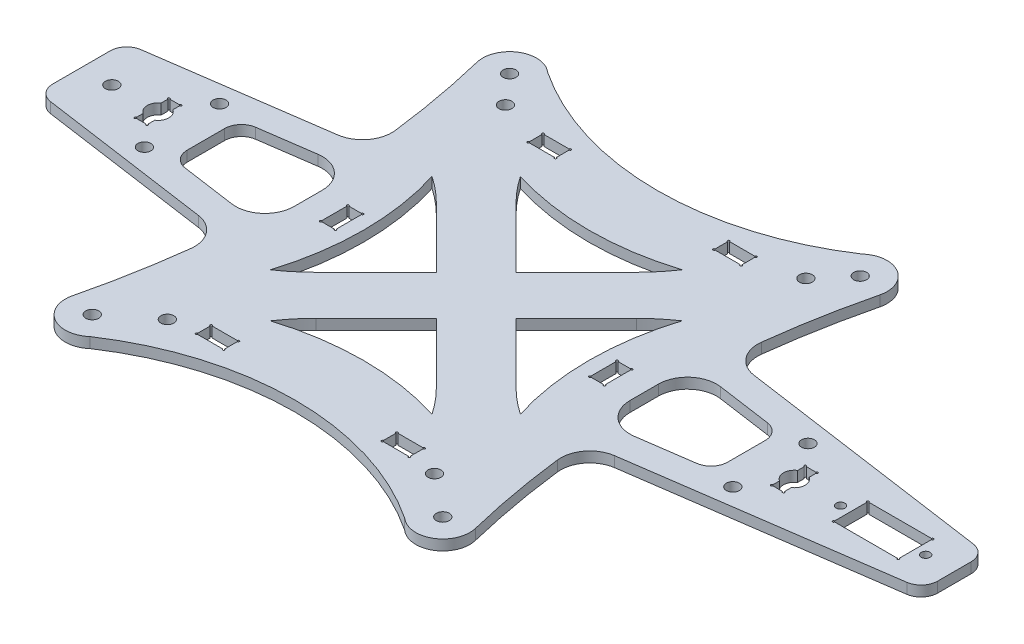
from build123d import *

# Parameters (mm, degrees)
SKETCH_1_R          = 1.55
SKETCH_1_R_2        = 1.05
SKETCH_1_W          = 6.5
SKETCH_1_H          = 3.5
SKETCH_1_W_2        = 3.5
SKETCH_1_H_2        = 6.5
SKETCH_1_W_3        = 15.5
SKETCH_1_H_3        = 8.2
EXTRUDE_1_DEPTH     = 2.5
FILLET_1_R          = 4
FILLET_2_R          = 7
SKETCH_2_R          = 0.25
CUT_EXTRUDE_1_DEPTH = 128.770204339


with BuildPart() as part:
    # 草图1 → 凸台-拉伸1 (new body)
    with BuildSketch(Plane(origin=(0, 0, 0), x_dir=(1, 0, 0), z_dir=(0, 1, 0))):
        with BuildLine():
            Line((114.591143215, 7.468307572), (114.591143215, -7.468307572))
            Line((114.591143215, -7.468307572), (43.193640968, -17.646273029))
            ThreePointArc((43.193640968, -17.646273029), (45.143245402, -33.15226541), (48.27557779, -48.463217404))
            ThreePointArc((48.27557779, -48.463217404), (45.335063646, -55.533708325), (37.709796983, -54.831018053))
            ThreePointArc((37.709796983, -54.831018053), (0, -43.436211003), (-37.709796983, -54.831018053))
            ThreePointArc((-37.709796983, -54.831018053), (-45.335063646, -55.533708325), (-48.27557779, -48.463217404))
            ThreePointArc((-48.27557779, -48.463217404), (-45.143245402, -33.15226541), (-43.193640968, -17.646273029))
            Line((-43.193640968, -17.646273029), (-94.579518436, -10.321035179))
            Line((-94.579518436, -10.321035179), (-94.579518436, 10.321035179))
            Line((-94.579518436, 10.321035179), (-43.193640968, 17.646273029))
            ThreePointArc((-43.193640968, 17.646273029), (-45.143245402, 33.15226541), (-48.27557779, 48.463217404))
            ThreePointArc((-48.27557779, 48.463217404), (-45.335063646, 55.533708325), (-37.709796983, 54.831018053))
            ThreePointArc((-37.709796983, 54.831018053), (0, 43.436211003), (37.709796983, 54.831018053))
            ThreePointArc((37.709796983, 54.831018053), (45.335063646, 55.533708325), (48.27557779, 48.463217404))
            ThreePointArc((48.27557779, 48.463217404), (45.143245402, 33.15226541), (43.193640968, 17.646273029))
            Line((43.193640968, 17.646273029), (114.591143215, 7.468307572))
        make_face()
        with Locations((-36, 43)):
            Circle(SKETCH_1_R, mode=Mode.SUBTRACT)
        with Locations((-32, -42)):
            Circle(SKETCH_1_R, mode=Mode.SUBTRACT)
        with Locations((32, -42)):
            Circle(SKETCH_1_R, mode=Mode.SUBTRACT)
        with Locations((36, 43)):
            Circle(SKETCH_1_R, mode=Mode.SUBTRACT)
        with Locations((42, 50)):
            Circle(SKETCH_1_R, mode=Mode.SUBTRACT)
        with Locations((42, -50)):
            Circle(SKETCH_1_R, mode=Mode.SUBTRACT)
        with Locations((-42, -50)):
            Circle(SKETCH_1_R, mode=Mode.SUBTRACT)
        with Locations((-42, 50)):
            Circle(SKETCH_1_R, mode=Mode.SUBTRACT)
        with Locations((107.7, 0)):
            Circle(SKETCH_1_R_2, mode=Mode.SUBTRACT)
        with Locations((87.3, 0)):
            Circle(SKETCH_1_R_2, mode=Mode.SUBTRACT)
        with Locations((70.5, 9)):
            Circle(SKETCH_1_R, mode=Mode.SUBTRACT)
        with Locations((70.5, -9)):
            Circle(SKETCH_1_R, mode=Mode.SUBTRACT)
        with Locations((-70.5, -9)):
            Circle(SKETCH_1_R, mode=Mode.SUBTRACT)
        with Locations((-70.5, 9)):
            Circle(SKETCH_1_R, mode=Mode.SUBTRACT)
        with Locations((-87.3, 0)):
            Circle(SKETCH_1_R, mode=Mode.SUBTRACT)
        with Locations((-22.25, 39.75)):
            Rectangle(SKETCH_1_W, SKETCH_1_H, mode=Mode.SUBTRACT)
        with Locations((-32.25, 0)):
            Rectangle(SKETCH_1_W_2, SKETCH_1_H_2, mode=Mode.SUBTRACT)
        with Locations((-22.25, -39.75)):
            Rectangle(SKETCH_1_W, SKETCH_1_H, mode=Mode.SUBTRACT)
        with Locations((22.25, 39.75)):
            Rectangle(SKETCH_1_W, SKETCH_1_H, mode=Mode.SUBTRACT)
        with Locations((22.25, -39.75)):
            Rectangle(SKETCH_1_W, SKETCH_1_H, mode=Mode.SUBTRACT)
        with Locations((32.25, 0)):
            Rectangle(SKETCH_1_W_2, SKETCH_1_H_2, mode=Mode.SUBTRACT)
        with BuildLine():
            Line((77.65, -2.151778405), (77.65, -4))
            Line((77.65, -4), (74.85, -4))
            Line((74.85, -4), (74.85, -2.176778405))
            ThreePointArc((74.85, -2.176778405), (73.652957971, 0), (74.85, 2.176778405))
            Line((74.85, 2.176778405), (74.85, 4))
            Line((74.85, 4), (77.65, 4))
            Line((77.65, 4), (77.65, 2.151778405))
            ThreePointArc((77.65, 2.151778405), (78.8083942, 0), (77.65, -2.151778405))
        make_face(mode=Mode.SUBTRACT)
        with Locations((97.5, 0)):
            Rectangle(SKETCH_1_W_3, SKETCH_1_H_3, mode=Mode.SUBTRACT)
        with BuildLine():
            Line((-74.85, -2.176778405), (-74.85, -4))
            Line((-74.85, -4), (-77.65, -4))
            Line((-77.65, -4), (-77.65, -2.151778405))
            ThreePointArc((-77.65, -2.151778405), (-78.8083942, 0), (-77.65, 2.151778405))
            Line((-77.65, 2.151778405), (-77.65, 4))
            Line((-77.65, 4), (-74.85, 4))
            Line((-74.85, 4), (-74.85, 2.176778405))
            ThreePointArc((-74.85, 2.176778405), (-73.652957971, 0), (-74.85, -2.176778405))
        make_face(mode=Mode.SUBTRACT)
        with BuildLine():
            Line((-23.978041684, 14.429581723), (-9.54845996, 0))
            Line((-9.54845996, 0), (-23.978041684, -14.429581723))
            ThreePointArc((-23.978041684, -14.429581723), (-26.851664039, -17.042325553), (-29.960234119, -19.370614155))
            ThreePointArc((-29.960234119, -19.370614155), (-27.006361348, 0), (-29.960234119, 19.370614155))
            ThreePointArc((-29.960234119, 19.370614155), (-26.851664039, 17.042325553), (-23.978041684, 14.429581723))
        make_face(mode=Mode.SUBTRACT)
        with BuildLine():
            Line((14.429581723, 23.978041684), (0, 9.54845996))
            Line((0, 9.54845996), (-14.429581723, 23.978041684))
            ThreePointArc((-14.429581723, 23.978041684), (-17.042325553, 26.851664039), (-19.370614155, 29.960234119))
            ThreePointArc((-19.370614155, 29.960234119), (0, 27.006361348), (19.370614155, 29.960234119))
            ThreePointArc((19.370614155, 29.960234119), (17.042325553, 26.851664039), (14.429581723, 23.978041684))
        make_face(mode=Mode.SUBTRACT)
        with BuildLine():
            Line((23.978041684, -14.429581723), (9.54845996, 0))
            Line((9.54845996, 0), (23.978041684, 14.429581723))
            ThreePointArc((23.978041684, 14.429581723), (26.851664039, 17.042325553), (29.960234119, 19.370614155))
            ThreePointArc((29.960234119, 19.370614155), (27.006361348, 0), (29.960234119, -19.370614155))
            ThreePointArc((29.960234119, -19.370614155), (26.851664039, -17.042325553), (23.978041684, -14.429581723))
        make_face(mode=Mode.SUBTRACT)
        with BuildLine():
            Line((-14.429581723, -23.978041684), (0, -9.54845996))
            Line((0, -9.54845996), (14.429581723, -23.978041684))
            ThreePointArc((14.429581723, -23.978041684), (17.042325553, -26.851664039), (19.370614155, -29.960234119))
            ThreePointArc((19.370614155, -29.960234119), (0, -27.006361348), (-19.370614155, -29.960234119))
            ThreePointArc((-19.370614155, -29.960234119), (-17.042325553, -26.851664039), (-14.429581723, -23.978041684))
        make_face(mode=Mode.SUBTRACT)
        Polygon((-64.75, -7.957119899), (-64.75, 7.957119899), (-40.25, 11.449681205), (-40.25, -11.449681205), align=None, mode=Mode.SUBTRACT)
        Polygon((64.75, 7.957119899), (40.25, 11.449681205), (40.25, -11.449681205), (64.75, -7.957119899), align=None, mode=Mode.SUBTRACT)
    extrude(amount=EXTRUDE_1_DEPTH)

    # 圆角1
    fillet_1_edges = [part.edges().sort_by_distance(p)[0] for p in [
        (114.591143215, 1.25, -7.468307572),
        (114.591143215, 1.25, 7.468307572),
        (-94.579518436, 1.25, 10.321035179),
        (-94.579518436, 1.25, -10.321035179),
        (-64.75, 1.25, 7.957119899),
        (-64.75, 1.25, -7.957119899),
        (64.75, 1.25, 7.957119899),
        (64.75, 1.25, -7.957119899),
    ]]
    fillet(fillet_1_edges, radius=FILLET_1_R)

    # 圆角2
    fillet_2_edges = [part.edges().sort_by_distance(p)[0] for p in [
        (43.193640968, 1.25, -17.646273029),
        (43.193640968, 1.25, 17.646273029),
        (-43.193640968, 1.25, 17.646273029),
        (-43.193640968, 1.25, -17.646273029),
        (40.25, 1.25, 11.449681205),
        (40.25, 1.25, -11.449681205),
        (-40.25, 1.25, 11.449681205),
        (-40.25, 1.25, -11.449681205),
    ]]
    fillet(fillet_2_edges, radius=FILLET_2_R)

    # 草图2 → 切除-拉伸1 (cut, through all)
    with BuildSketch(Plane(origin=(0, 2.5, 0), x_dir=(1, 0, 0), z_dir=(0, 1, 0))):
        with Locations((-77.65, 4)):
            Circle(SKETCH_2_R)
        with Locations((-74.85, 4)):
            Circle(SKETCH_2_R)
        with Locations((-77.65, -4)):
            Circle(SKETCH_2_R)
        with Locations((-74.85, -4)):
            Circle(SKETCH_2_R)
        with Locations((-25.5, 41.5)):
            Circle(SKETCH_2_R)
        with Locations((-19, 41.5)):
            Circle(SKETCH_2_R)
        with Locations((-25.5, 38)):
            Circle(SKETCH_2_R)
        with Locations((-19, 38)):
            Circle(SKETCH_2_R)
        with Locations((-34, 3.25)):
            Circle(SKETCH_2_R)
        with Locations((-30.5, 3.25)):
            Circle(SKETCH_2_R)
        with Locations((-34, -3.25)):
            Circle(SKETCH_2_R)
        with Locations((-30.5, -3.25)):
            Circle(SKETCH_2_R)
        with Locations((-25.5, -38)):
            Circle(SKETCH_2_R)
        with Locations((-19, -38)):
            Circle(SKETCH_2_R)
        with Locations((-25.5, -41.5)):
            Circle(SKETCH_2_R)
        with Locations((-19, -41.5)):
            Circle(SKETCH_2_R)
        with Locations((19, -41.5)):
            Circle(SKETCH_2_R)
        with Locations((25.5, -41.5)):
            Circle(SKETCH_2_R)
        with Locations((19, -38)):
            Circle(SKETCH_2_R)
        with Locations((25.5, -38)):
            Circle(SKETCH_2_R)
        with Locations((30.5, -3.25)):
            Circle(SKETCH_2_R)
        with Locations((34, -3.25)):
            Circle(SKETCH_2_R)
        with Locations((30.5, 3.25)):
            Circle(SKETCH_2_R)
        with Locations((34, 3.25)):
            Circle(SKETCH_2_R)
        with Locations((19, 38)):
            Circle(SKETCH_2_R)
        with Locations((25.5, 38)):
            Circle(SKETCH_2_R)
        with Locations((19, 41.5)):
            Circle(SKETCH_2_R)
        with Locations((25.5, 41.5)):
            Circle(SKETCH_2_R)
        with Locations((74.85, -4)):
            Circle(SKETCH_2_R)
        with Locations((77.65, -4)):
            Circle(SKETCH_2_R)
        with Locations((74.85, 4)):
            Circle(SKETCH_2_R)
        with Locations((77.65, 4)):
            Circle(SKETCH_2_R)
        with Locations((89.75, 4.1)):
            Circle(SKETCH_2_R)
        with Locations((105.25, 4.1)):
            Circle(SKETCH_2_R)
        with Locations((89.75, -4.1)):
            Circle(SKETCH_2_R)
        with Locations((105.25, -4.1)):
            Circle(SKETCH_2_R)
    extrude(amount=-CUT_EXTRUDE_1_DEPTH, mode=Mode.SUBTRACT)


solid = part.part
